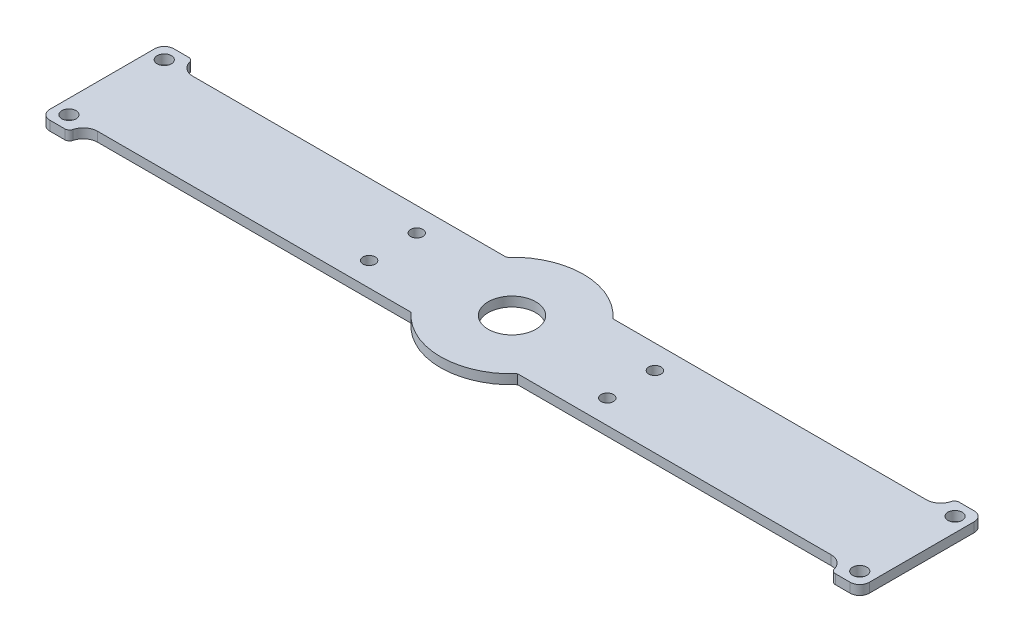
from build123d import *

# Parameters (mm, degrees)
SKETCH_1_R          = 5
EXTRUDE_1_DEPTH     = 2
SKETCH_2_R          = 1.3
CUT_EXTRUDE_1_DEPTH = 2
SKETCH_3_W          = 6
SKETCH_3_H          = 26
SKETCH_3_R          = 1.5
EXTRUDE_2_DEPTH     = 2
FILLET_1_R          = 3
FILLET_2_R          = 2
FILLET_3_R          = 1


with BuildPart() as part:
    # 草图1 → 凸台-拉伸1 (new body)
    with BuildSketch(Plane(origin=(0, 0, 0), x_dir=(1, 0, 0), z_dir=(0, 1, 0))):
        with BuildLine():
            Line((11.180339887, 10), (80, 10))
            Line((80, 10), (80, -10))
            Line((80, -10), (11.180339887, -10))
            ThreePointArc((11.180339887, -10), (0, -15), (-11.180339887, -10))
            Line((-11.180339887, -10), (-80, -10))
            Line((-80, -10), (-80, 10))
            Line((-80, 10), (-11.180339887, 10))
            ThreePointArc((-11.180339887, 10), (0, 15), (11.180339887, 10))
        make_face()
        with Locations(Location((0, 0, 0), (0, 0, 270))):
            Circle(SKETCH_1_R, mode=Mode.SUBTRACT)
    extrude(amount=EXTRUDE_1_DEPTH)

    # 草图2 → 切除-拉伸1 (cut)
    with BuildSketch(Plane(origin=(0, 2, 0), x_dir=(1, 0, 0), z_dir=(0, 1, 0))):
        with Locations(Location((-25, 5, 0), (0, 0, 270))):
            Circle(SKETCH_2_R)
        with Locations(Location((-25, -5, 0), (0, 0, 90))):
            Circle(SKETCH_2_R)
        with Locations(Location((25, -5, 0), (0, 0, 270))):
            Circle(SKETCH_2_R)
        with Locations(Location((25, 5, 0), (0, 0, 90))):
            Circle(SKETCH_2_R)
    extrude(amount=-CUT_EXTRUDE_1_DEPTH, mode=Mode.SUBTRACT)

    # 草图3 → 凸台-拉伸2 (add)
    # profile 1 of 2: a face of its own
    with BuildSketch(Plane(origin=(0, 0, 0), x_dir=(1, 0, 0), z_dir=(0, 1, 0))):
        with Locations((-83, 0)):
            Rectangle(SKETCH_3_W, SKETCH_3_H)
        with Locations(Location((-83, 10, 0), (0, 0, 270))):
            Circle(SKETCH_3_R, mode=Mode.SUBTRACT)
        with Locations(Location((-83, -10, 0), (0, 0, 90))):
            Circle(SKETCH_3_R, mode=Mode.SUBTRACT)
    # profile 2 of 2: a face of its own
    with BuildSketch(Plane(origin=(0, 0, 0), x_dir=(1, 0, 0), z_dir=(0, 1, 0))):
        with Locations((83, 0)):
            Rectangle(SKETCH_3_W, SKETCH_3_H)
        with Locations(Location((83, -10, 0), (0, 0, 270))):
            Circle(SKETCH_3_R, mode=Mode.SUBTRACT)
        with Locations(Location((83, 10, 0), (0, 0, 90))):
            Circle(SKETCH_3_R, mode=Mode.SUBTRACT)
    extrude(amount=EXTRUDE_2_DEPTH)

    # 圆角1
    fillet_1_edges = [part.edges().sort_by_distance(p)[0] for p in [
        (80, 1, 10),
        (80, 1, -10),
        (-80, 1, -10),
        (-80, 1, 10),
    ]]
    fillet(fillet_1_edges, radius=FILLET_1_R - 0.0001)  # a hair under: the kernel refuses the full size

    # 圆角2
    fillet_2_edges = [part.edges().sort_by_distance(p)[0] for p in [
        (-86, 1, 13),
        (-86, 1, -13),
        (86, 1, 13),
        (86, 1, -13),
    ]]
    fillet(fillet_2_edges, radius=FILLET_2_R)

    # 圆角3
    fillet_3_edges = [part.edges().sort_by_distance(p)[0] for p in [
        (-80, 1, 13),
        (-80, 1, -13),
        (80, 1, -13),
        (80, 1, 13),
    ]]
    fillet(fillet_3_edges, radius=FILLET_3_R)


solid = part.part
